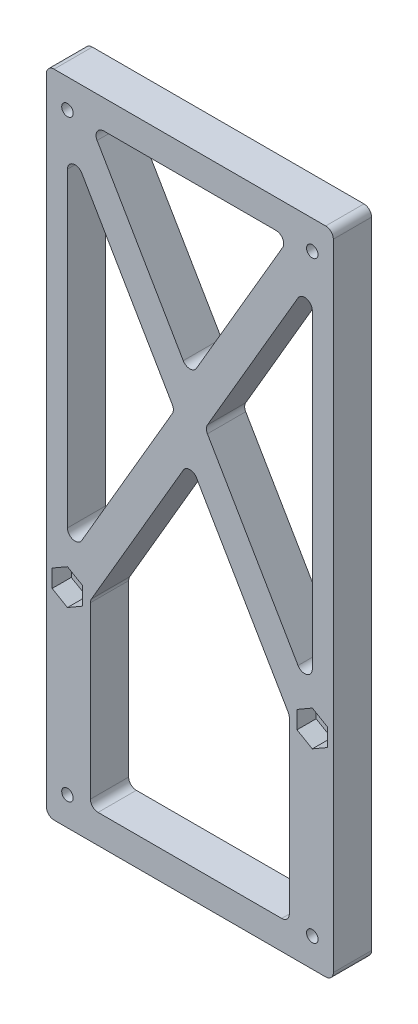
from build123d import *

# Parameters (mm, degrees)
SKETCH1_W           = 170
SKETCH1_H           = 75
BOSS_EXTRUDE1_DEPTH = 10
SKETCH2_R           = 1.5
CUT_EXTRUDE1_DEPTH  = 94.441157955
CUT_EXTRUDE2_DEPTH  = 94.441157955
FILLET1_R           = 2
CUT_EXTRUDE3_DEPTH  = 5


with BuildPart() as part:
    # Sketch1 → Boss-Extrude1 (new body)
    with BuildSketch(Plane(origin=(0, 0, 0), x_dir=(0, 1, 0), z_dir=(0, 0, 1))):
        Rectangle(SKETCH1_W, SKETCH1_H)
    extrude(amount=BOSS_EXTRUDE1_DEPTH)

    # Sketch2 → Cut-Extrude1 (cut, through all)
    with BuildSketch(Plane.XY.offset(10)):
        with Locations((-32, 77.5)):
            Circle(SKETCH2_R)
        with Locations((-32, -30.5)):
            Circle(SKETCH2_R)
        with Locations((-32, -77.5)):
            Circle(SKETCH2_R)
        with Locations((32, -77.5)):
            Circle(SKETCH2_R)
        with Locations((32, -30.5)):
            Circle(SKETCH2_R)
        with Locations((32, 77.5)):
            Circle(SKETCH2_R)
    extrude(amount=-CUT_EXTRUDE1_DEPTH, mode=Mode.SUBTRACT)

    # Sketch4 → Cut-Extrude2 (cut, through all)
    with BuildSketch(Plane.XY.offset(10)):
        Polygon((-32, -24.5), (-32, 71.5), (-4, 23.5), align=None)
        Polygon((-26, 77.5), (26, 77.5), (0, 32.928571429), align=None)
        Polygon((32, 71.5), (4, 23.5), (32, -24.5), align=None)
        Polygon((26, -30.5), (0, 14.071428571), (-26, -30.5), (-26, -77.5), (26, -77.5), align=None)
    extrude(amount=-CUT_EXTRUDE2_DEPTH, mode=Mode.SUBTRACT)

    # Fillet1
    fillet1_edges = [part.edges().sort_by_distance(p)[0] for p in [
        (-26, -77.5, 5),
        (26, -77.5, 5),
        (26, -30.5, 5),
        (-26, -30.5, 5),
        (0, 14.071428571, 5),
        (4, 23.5, 5),
        (-4, 23.5, 5),
        (0, 32.928571429, 5),
        (32, 71.5, 5),
        (26, 77.5, 5),
        (-32, 71.5, 5),
        (-26, 77.5, 5),
        (-32, -24.5, 5),
        (32, -24.5, 5),
        (-37.5, -85, 5),
        (37.5, -85, 5),
        (-37.5, 85, 5),
        (37.5, 85, 5),
    ]]
    fillet(fillet1_edges, radius=FILLET1_R)

    # Sketch5 → Cut-Extrude3 (cut)
    with BuildSketch(Plane.XY.offset(10)):
        Polygon((-28, -32.809401077), (-28, -28.190598923), (-32, -25.881197846), (-36, -28.190598923), (-36, -32.809401077), (-32, -35.118802154), align=None)
        Polygon((32, -35.118802154), (28, -32.809401077), (28, -28.190598923), (32, -25.881197846), (36, -28.190598923), (36, -32.809401077), align=None)
    extrude(amount=-CUT_EXTRUDE3_DEPTH, mode=Mode.SUBTRACT)


solid = part.part
